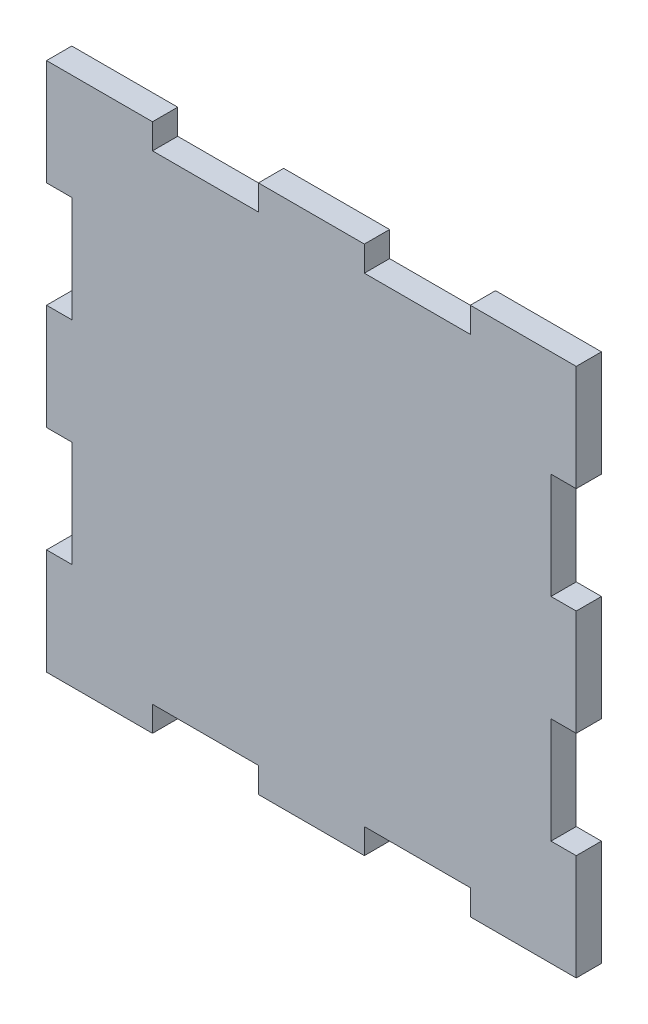
from build123d import *

# Parameters (mm, degrees)
BOSS_EXTRUDE1_DEPTH = 4.7625
CAVITY1_START       = -30
CAVITY1_OUTLINE_W   = 4.7625
CAVITY1_OUTLINE_H   = 4.7625
CAVITY1_DEPTH       = 20
CAVITY1_START_2     = 10
CAVITY1_2_OUTLINE_W = 4.7625
CAVITY1_2_OUTLINE_H = 4.7625
CAVITY1_2_DEPTH     = 20


# Read off the part's stored shape, not the designer's step: Cavity1
with BuildPart() as part:
    # Sketch1 → Boss-Extrude1 (new body)
    with BuildSketch(Plane.XY):
        Polygon((50, 40), (50, 60), (45.2375, 60), (45.2375, 80), (50, 80), (50, 100), (-50, 100), (-50, 80), (-45.2375, 80), (-45.2375, 60), (-50, 60), (-50, 40), (-45.2375, 40), (-45.2375, 20), (-50, 20), (-50, 0), (-30, 0), (-30, 4.7625), (-10, 4.7625), (-10, 0), (10, 0), (10, 4.7625), (30, 4.7625), (30, 0), (50, 0), (50, 20), (45.2375, 20), (45.2375, 40), align=None)
    extrude(amount=BOSS_EXTRUDE1_DEPTH)

    # Cavity1 outline → Cavity1 (cut)
    with BuildSketch(Plane.YZ.offset(CAVITY1_START)):
        with Locations((97.61875, 2.38125)):
            Rectangle(CAVITY1_OUTLINE_W, CAVITY1_OUTLINE_H)
    extrude(amount=CAVITY1_DEPTH, mode=Mode.SUBTRACT)

    # Cavity1 2 outline → Cavity1 2 (cut)
    with BuildSketch(Plane.YZ.offset(CAVITY1_START_2)):
        with Locations((97.61875, 2.38125)):
            Rectangle(CAVITY1_2_OUTLINE_W, CAVITY1_2_OUTLINE_H)
    extrude(amount=CAVITY1_2_DEPTH, mode=Mode.SUBTRACT)


solid = part.part
